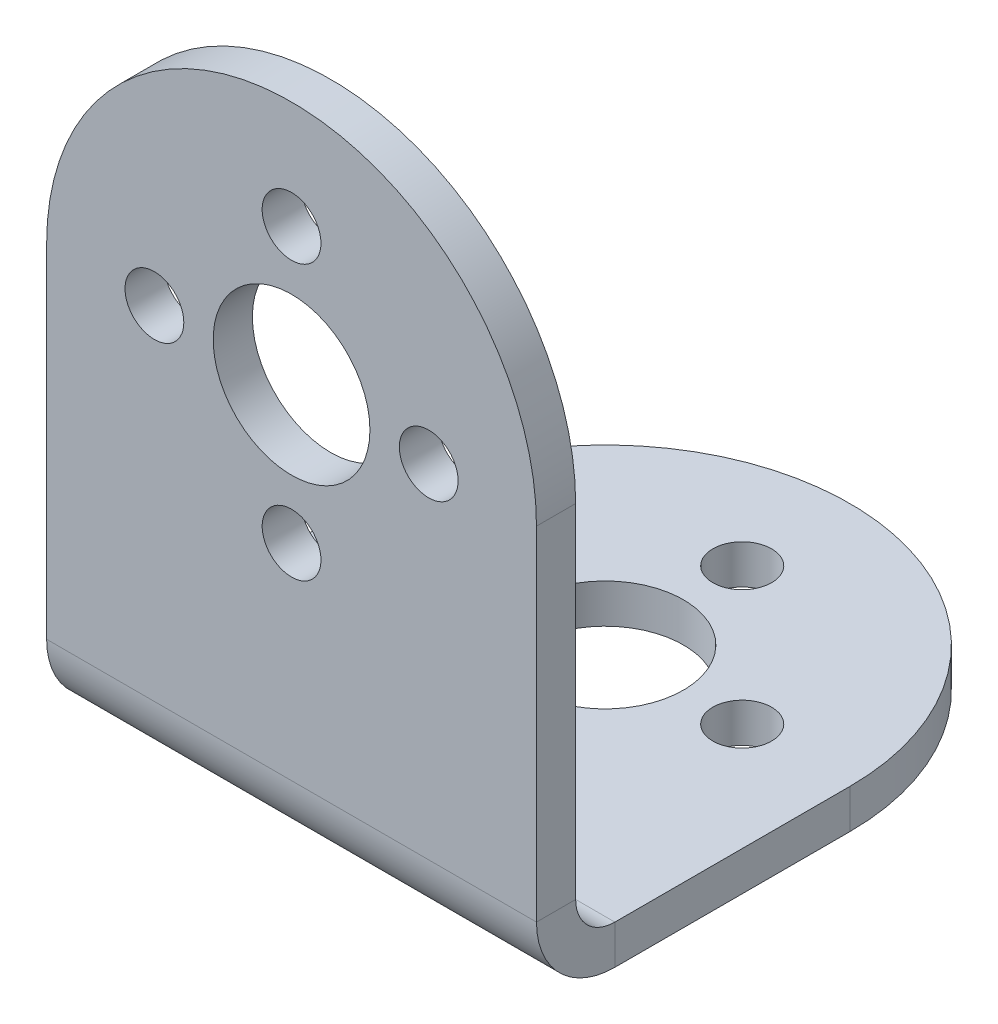
from build123d import *

# Parameters (mm, degrees)
BASE_FLANGE1_DEPTH           = 2
EDGE_FLANGE1_STRIP_W         = 12
EDGE_FLANGE1_STRIP_H         = 2
EDGE_FLANGE1_STRIP_CUT_DEPTH = 25
EDGE_FLANGE1_DEPTH           = 25
SKETCH19_R                   = 4
CUT_EXTRUDE2_DEPTH           = 45.637428241
M3X0_5_TAPPED_HOLE1_D        = 3
SKETCH22_R                   = 4
CUT_EXTRUDE3_DEPTH           = 45.637428241
M3X0_5_TAPPED_HOLE2_D        = 3


# Sheet-metal steps are written as plain solids
with BuildPart() as part:
    # Sketch8 → Base-Flange1 (new body)
    with BuildSketch(Plane.XY):
        with BuildLine():
            Line((-12.5, 0), (12.5, 0))
            Line((12.5, 0), (12.5, 19.5))
            ThreePointArc((12.5, 19.5), (0, 32), (-12.5, 19.5))
            Line((-12.5, 19.5), (-12.5, 0))
        make_face()
    extrude(amount=-BASE_FLANGE1_DEPTH)

    # Edge-Flange1 strip (across the edge) → Edge-Flange1 strip cut (cut)
    with BuildSketch(Plane(origin=(12.5, 0, -2), x_dir=(0, 1, 0), z_dir=(-1, 0, 0))):
        with Locations((-4, -1)):
            Rectangle(EDGE_FLANGE1_STRIP_W, EDGE_FLANGE1_STRIP_H)
    extrude(amount=EDGE_FLANGE1_STRIP_CUT_DEPTH, mode=Mode.SUBTRACT)

    # Edge-Flange1 section (across the edge) → Edge-Flange1 (add)
    with BuildSketch(Plane(origin=(12.5, 0, -2), x_dir=(0, 1, 0), z_dir=(-1, 0, 0))):
        with BuildLine():
            Line((-2, 2), (-2, 26.5))
            Line((-2, 26.5), (0, 26.5))
            Line((0, 26.5), (0, 2))
            ThreePointArc((0, 2), (0.585786438, 0.585786438), (2, 0))
            Line((2, 0), (2, -2))
            ThreePointArc((2, -2), (-0.828427125, -0.828427125), (-2, 2))
        make_face()
    extrude(amount=EDGE_FLANGE1_DEPTH)

    # Sketch19 → Cut-Extrude2 (cut, through all)
    with BuildSketch(Plane.XY):
        with Locations((0, 19.5)):
            Circle(SKETCH19_R)
    extrude(amount=-CUT_EXTRUDE2_DEPTH, mode=Mode.SUBTRACT)

    # M3x0.5 Tapped Hole1 (through all)
    with Locations(Plane.XY):
        with Locations((0, 26.5), (-7, 19.5), (0, 12.5), (7, 19.5)):
            Hole(M3X0_5_TAPPED_HOLE1_D / 2)

    # Sketch22 → Cut-Extrude3 (cut, through all)
    with BuildSketch(Plane(origin=(0, 0, 0), x_dir=(1, 0, 0), z_dir=(0, 1, 0))):
        with BuildLine():
            ThreePointArc((2.8e-08, 28.5), (8.838834775, 24.838834755), (12.5, 16))
            Line((12.5, 16), (12.5, 28.5))
            Line((12.5, 28.5), (2.8e-08, 28.5))
        make_face()
        with BuildLine():
            ThreePointArc((-12.5, 16), (-8.838834755, 24.838834775), (2.8e-08, 28.5))
            Line((2.8e-08, 28.5), (-12.5, 28.5))
            Line((-12.5, 28.5), (-12.5, 16))
        make_face()
        with Locations(Location((0, 16, 0), (0, 0, 270))):
            Circle(SKETCH22_R)
    extrude(amount=-CUT_EXTRUDE3_DEPTH, mode=Mode.SUBTRACT)

    # M3x0.5 Tapped Hole2 (through all)
    with Locations(Plane(origin=(0, 0, 0), x_dir=(1, 0, 0), z_dir=(0, 1, 0))):
        with Locations((7, 16), (-7, 16), (0, 23), (0, 9)):
            Hole(M3X0_5_TAPPED_HOLE2_D / 2)


solid = part.part
